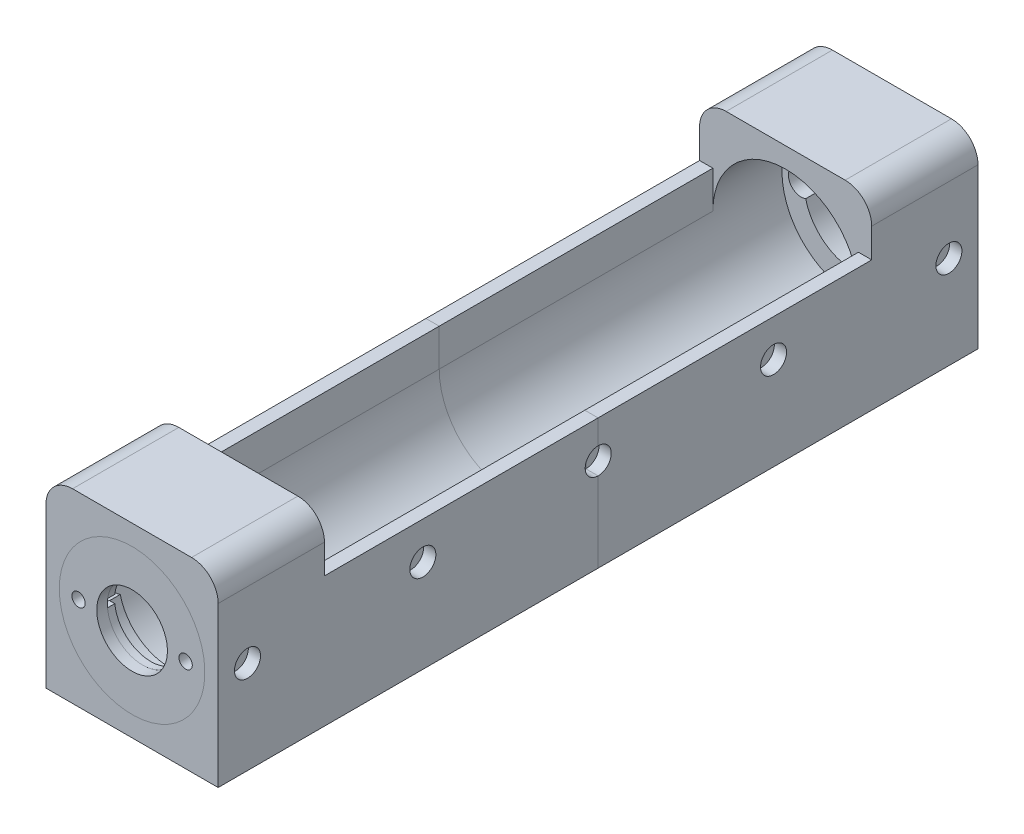
from build123d import *
from build123d.topology import SkipClean

# Parameters (mm, degrees)
CROQUIS1_R              = 13.7
SALIENTE_EXTRUIR1_DEPTH = 5
CROQUIS2_R              = 9.5
CORTAR_EXTRUIR1_DEPTH   = 3.5
CROQUIS3_R              = 6.8
CORTAR_EXTRUIR2_DEPTH   = 3
SALIENTE_EXTRUIR2_START = 2
CROQUIS4_R              = 13.7
CROQUIS4_R_2            = 6.65
SALIENTE_EXTRUIR2_DEPTH = 2
CROQUIS5_R              = 1.25
CORTAR_EXTRUIR3_DEPTH   = 21.600485431
CROQUIS6_W              = 32.4
CROQUIS6_H              = 35
CROQUIS6_R              = 13.7
SALIENTE_EXTRUIR3_DEPTH = 20
SALIENTE_EXTRUIR5_DEPTH = 51.5
CROQUIS9_R              = 2.45
CORTAR_EXTRUIR4_DEPTH   = 2.3
REDONDEO1_R             = 5
REDONDEO2_R             = 5


with BuildPart() as part:
    # Croquis1 → Saliente-Extruir1 (new body)
    with BuildSketch(Plane.XY):
        Circle(CROQUIS1_R)
        with BuildLine():
            Line((0, 0.75), (7.800197377, 0.75))
            ThreePointArc((7.800197377, 0.75), (10.459785271, 2.369760146), (12.48, 0))
            ThreePointArc((12.48, 0), (10.459785271, -2.369760146), (7.800197377, -0.75))
            Line((7.800197377, -0.75), (0, -0.75))
            Line((0, -0.75), (-7.800197377, -0.75))
            ThreePointArc((-7.800197377, -0.75), (-12.48, 0), (-7.800197377, 0.75))
            Line((-7.800197377, 0.75), (0, 0.75))
        make_face(mode=Mode.SUBTRACT)
    extrude(amount=SALIENTE_EXTRUIR1_DEPTH)

    # Croquis2 → Cortar-Extruir1 (cut)
    with BuildSketch(Plane.XY.offset(5)):
        Circle(CROQUIS2_R)
    extrude(amount=-CORTAR_EXTRUIR1_DEPTH, mode=Mode.SUBTRACT)

    # Croquis3 → Cortar-Extruir2 (cut)
    with BuildSketch(Plane.XY.offset(1.5)):
        Circle(CROQUIS3_R)
    extrude(amount=-CORTAR_EXTRUIR2_DEPTH, mode=Mode.SUBTRACT)

    # Croquis4 → Saliente-Extruir2 (add)
    with BuildSketch(Plane(origin=(0, 0, 0), x_dir=(-1, 0, 0), z_dir=(0, 0, -1)).offset(SALIENTE_EXTRUIR2_START)):
        Circle(CROQUIS4_R)
        Circle(CROQUIS4_R_2, mode=Mode.SUBTRACT)
    extrude(amount=-SALIENTE_EXTRUIR2_DEPTH)

    # Croquis5 → Cortar-Extruir3 (cut, through all)
    with BuildSketch(Plane.XY.offset(5)):
        with Locations((-10.08, 0)):
            Circle(CROQUIS5_R)
        with Locations((10.08, 0)):
            Circle(CROQUIS5_R)
    extrude(amount=-CORTAR_EXTRUIR3_DEPTH, mode=Mode.SUBTRACT)


with BuildPart() as body_2:
    # Croquis6 → Saliente-Extruir3 (new body)
    with BuildSketch(Plane(origin=(0, 0, -2), x_dir=(-1, 0, 0), z_dir=(0, 0, -1))):
        Rectangle(CROQUIS6_W, CROQUIS6_H)
        Circle(CROQUIS6_R, mode=Mode.SUBTRACT)
    extrude(amount=-SALIENTE_EXTRUIR3_DEPTH)

    # Croquis8 → Saliente-Extruir5 (add)
    with BuildSketch(Plane.XY.offset(18)):
        with BuildLine():
            Line((-16.2, 7), (-16.2, -17.5))
            Line((-16.2, -17.5), (16.2, -17.5))
            Line((16.2, -17.5), (16.2, 7))
            Line((16.2, 7), (13.7, 7))
            Line((13.7, 7), (13.7, 0))
            ThreePointArc((13.7, 0), (0, -13.7), (-13.7, 0))
            Line((-13.7, 0), (-13.7, 7))
            Line((-13.7, 7), (-16.2, 7))
        make_face()
    extrude(amount=SALIENTE_EXTRUIR5_DEPTH)


with BuildPart() as body_3:
    # Simetría10: mirrored copy
    add(part.part.mirror(Plane.XY.offset(69.5)))


with BuildPart() as body_4:
    # Simetr_a10 2: mirrored copy
    add(body_2.part.mirror(Plane.XY.offset(69.5)))


with BuildPart() as cortar_extruir4_tool:
    # Croquis9 → Cortar-Extruir4 (new body)
    with SkipClean():  # the faces are left unmerged after this step: merging them gives an invalid solid
        with BuildSketch(Plane.ZY.offset(16.2)):
            with Locations((3.479126344, 0)):
                Circle(CROQUIS9_R)
            with Locations((36.479126344, 0)):
                Circle(CROQUIS9_R)
            with Locations((69.479126344, 0)):
                Circle(CROQUIS9_R)
            with Locations((102.479126344, 0)):
                Circle(CROQUIS9_R)
            with Locations((135.479126344, 0)):
                Circle(CROQUIS9_R)
        cortar_extruir4 = extrude(amount=-CORTAR_EXTRUIR4_DEPTH)


with BuildPart() as body_2_1:
    with SkipClean():  # the faces are left unmerged after this step: merging them gives an invalid solid
        add(body_2.part)

        # Cortar-Extruir4: cut by cortar_extruir4_tool
        add(cortar_extruir4_tool.part, mode=Mode.SUBTRACT)


with BuildPart() as body_4_1:
    with SkipClean():  # the faces are left unmerged after this step: merging them gives an invalid solid
        add(body_4.part)

        # Cortar-Extruir4: cut by cortar_extruir4_tool
        add(cortar_extruir4_tool.part, mode=Mode.SUBTRACT)


with BuildPart() as simetr_a11_tool:
    # Simetría11: Cortar-Extruir4 across plane
    with SkipClean():  # the faces are left unmerged after this step: merging them gives an invalid solid
        add(cortar_extruir4.mirror(Plane(origin=(0, 0, 0), x_dir=(0, 0, 1), z_dir=(1, 0, 0))))


with BuildPart() as body_2_2:
    with SkipClean():  # the faces are left unmerged after this step: merging them gives an invalid solid
        add(body_2_1.part)

        # Simetría11: cut by simetr_a11_tool
        add(simetr_a11_tool.part, mode=Mode.SUBTRACT)

    # Redondeo1
    redondeo1_edges = [body_2_2.edges().sort_by_distance(p)[0] for p in [
        (16.2, 17.5, 8),
        (-16.2, 17.5, 8),
    ]]
    fillet(redondeo1_edges, radius=REDONDEO1_R)


with BuildPart() as body_4_2:
    with SkipClean():  # the faces are left unmerged after this step: merging them gives an invalid solid
        add(body_4_1.part)

        # Simetría11: cut by simetr_a11_tool
        add(simetr_a11_tool.part, mode=Mode.SUBTRACT)

    # Redondeo2
    redondeo2_edges = [body_4_2.edges().sort_by_distance(p)[0] for p in [
        (16.2, 17.5, 131),
        (-16.2, 17.5, 131),
    ]]
    fillet(redondeo2_edges, radius=REDONDEO2_R)


solid = Compound([part.part, body_3.part, body_2_2.part, body_4_2.part])
